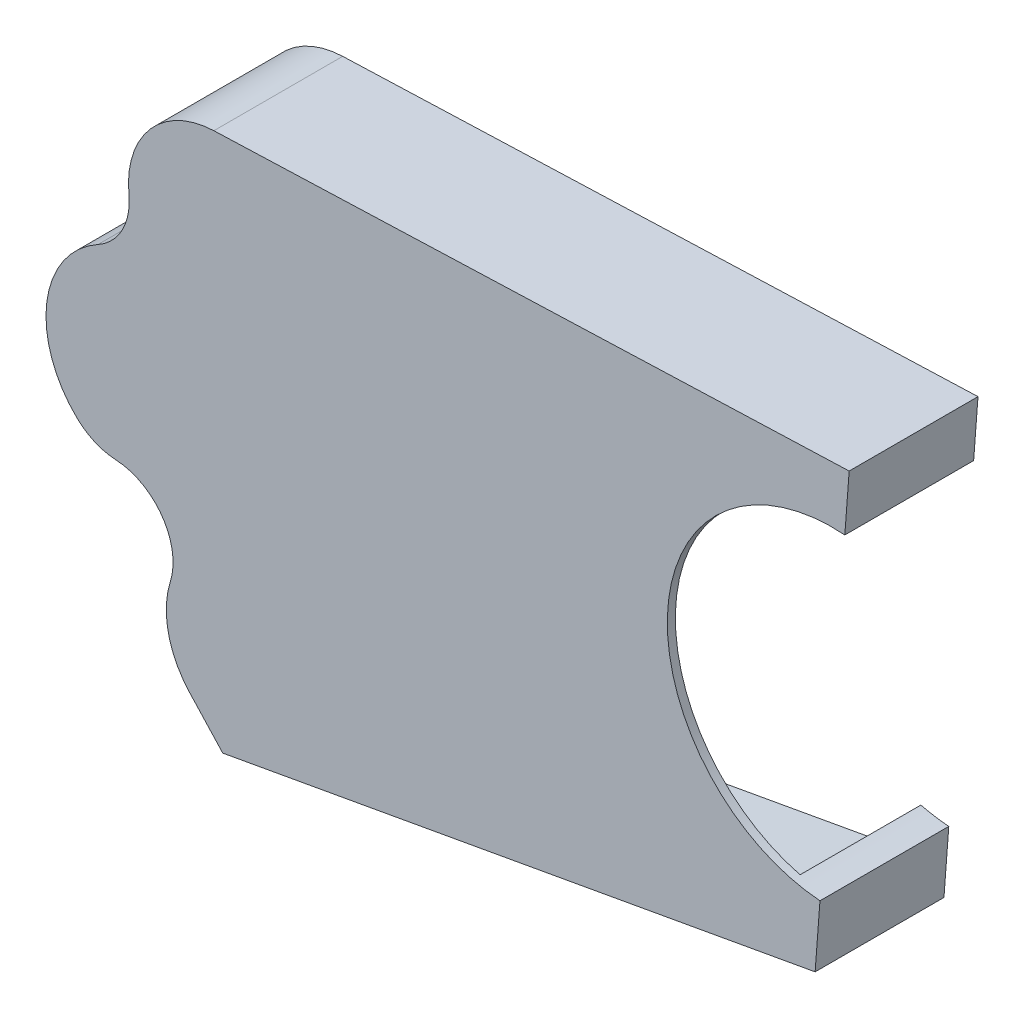
from build123d import *

# Parameters (mm, degrees)
BOSS_EXTRUDE1_DEPTH = 30
BOSS_EXTRUDE2_DEPTH = 2


with BuildPart() as part:
    # Sketch1 → Boss-Extrude1 (new body)
    with BuildSketch(Plane.XY):
        with BuildLine():
            ThreePointArc((-124.422839539, -52.93360637), (-124.888175134, -64.31939994), (-119.594822483, -74.410646153))
            Line((-119.594822483, -74.410646153), (-111.407238253, -83.286865316))
            Line((-111.407238253, -83.286865316), (35.730934718, -56.776536745))
            Line((35.730934718, -56.776536745), (36.930910469, -40.883630255))
            ThreePointArc((36.930910469, -40.883630255), (33.439314406, -40.468799845), (29.996101301, -39.756331708))
            Line((29.996101301, -39.756331708), (29.158639343, -50.847976334))
            Line((29.158639343, -50.847976334), (-108.867065108, -75.716483958))
            Line((-108.867065108, -75.716483958), (-114.449508902, -69.664516346))
            ThreePointArc((-114.449508902, -69.664516346), (-118.058612981, -62.784121201), (-117.741338712, -55.021080131))
            ThreePointArc((-117.741338712, -55.021080131), (-120.686835144, -35.887822689), (-137.611023, -26.489452883))
            ThreePointArc((-137.611023, -26.489452883), (-140.360427807, -25.849420576), (-142.716361529, -24.294285714))
            ThreePointArc((-142.716361529, -24.294285714), (-148.157403518, -8.953967174), (-139.001078611, 4.503076521))
            ThreePointArc((-139.001078611, 4.503076521), (-130.143335416, 13.552732011), (-127.741520279, 25.986040624))
            ThreePointArc((-127.741520279, 25.986040624), (-124.12688517, 37.354531527), (-113.359672518, 42.490220779))
            Line((-113.359672518, 42.490220779), (36.615125644, 47.908385572))
            Line((36.615125644, 47.908385572), (36.079199256, 40.810385494))
            ThreePointArc((36.079199256, 40.810385494), (39.590354856, 40.997771966), (43.104654075, 40.883630255))
            Line((43.104654075, 40.883630255), (44.184569482, 55.186414758))
            Line((44.184569482, 55.186414758), (-113.612397826, 49.485657143))
            ThreePointArc((-113.612397826, 49.485657143), (-129.404309715, 41.953312906), (-134.705774542, 25.279526249))
            ThreePointArc((-134.705774542, 25.279526249), (-136.343375771, 16.802270376), (-142.382746132, 10.632050724))
            ThreePointArc((-142.382746132, 10.632050724), (-155.099864059, -8.058287742), (-147.542861296, -29.364285714))
            ThreePointArc((-147.542861296, -29.364285714), (-143.125485566, -32.280163581), (-137.970351553, -33.480224156))
            ThreePointArc((-137.970351553, -33.480224156), (-126.431132561, -39.888203569), (-124.422839539, -52.93360637))
        make_face()
    extrude(amount=BOSS_EXTRUDE1_DEPTH)

    # Sketch4 → Boss-Extrude2 (add)
    with BuildSketch(Plane.XY.offset(30)):
        with BuildLine():
            ThreePointArc((36.930910469, -40.883630255), (-0.865847983, 3.086871803), (43.104654075, 40.883630255))
            Line((43.104654075, 40.883630255), (44.184569482, 55.186414758))
            Line((44.184569482, 55.186414758), (-113.612397826, 49.485657143))
            ThreePointArc((-113.612397826, 49.485657143), (-129.404309715, 41.953312906), (-134.705774542, 25.279526249))
            ThreePointArc((-134.705774542, 25.279526249), (-136.343375771, 16.802270376), (-142.382746132, 10.632050724))
            ThreePointArc((-142.382746132, 10.632050724), (-155.099864059, -8.058287742), (-147.542861296, -29.364285714))
            ThreePointArc((-147.542861296, -29.364285714), (-143.125485566, -32.280163581), (-137.970351553, -33.480224156))
            ThreePointArc((-137.970351553, -33.480224156), (-126.431132561, -39.888203569), (-124.422839539, -52.93360637))
            ThreePointArc((-124.422839539, -52.93360637), (-124.888175134, -64.31939994), (-119.594822483, -74.410646153))
            Line((-119.594822483, -74.410646153), (-111.407238253, -83.286865316))
            Line((-111.407238253, -83.286865316), (35.730934718, -56.776536745))
            Line((35.730934718, -56.776536745), (36.930910469, -40.883630255))
        make_face()
    extrude(amount=BOSS_EXTRUDE2_DEPTH)


solid = part.part
